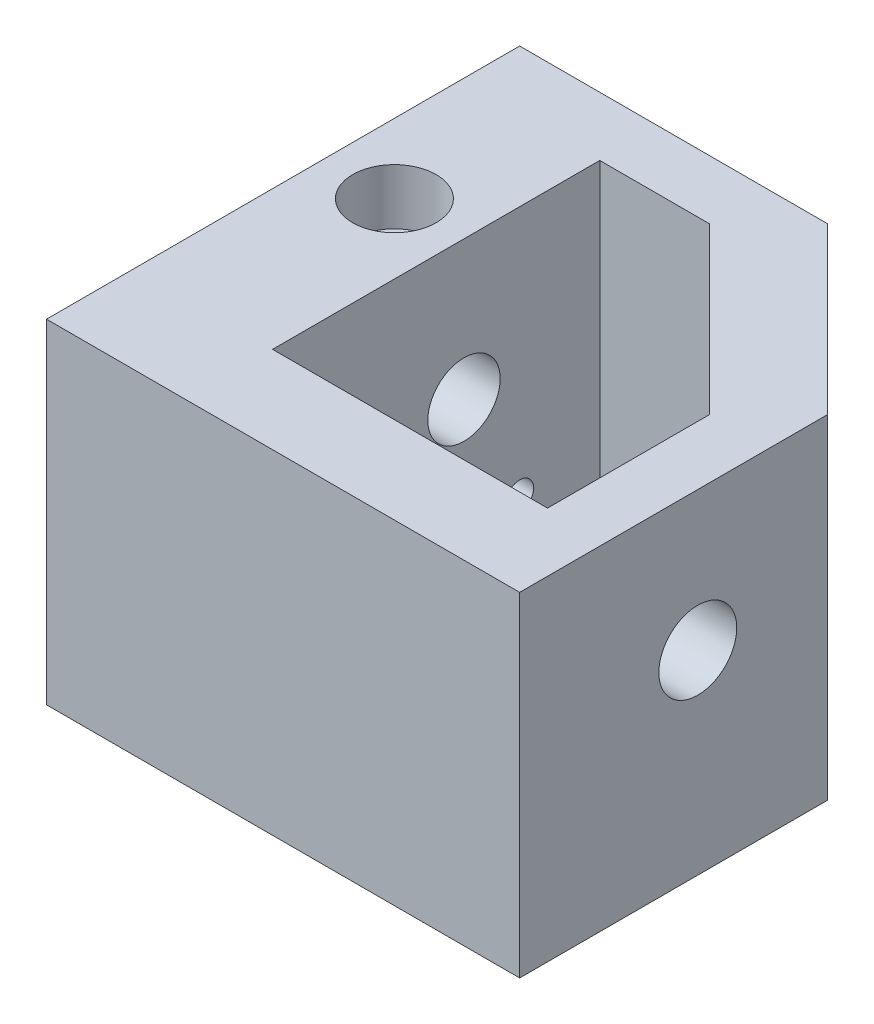
from build123d import *

# Parameters (mm, degrees)
BOSS_EXTRUDE2_DEPTH = 60
BOSS_EXTRUDE3_DEPTH = 10
CUT_EXTRUDE2_REACH  = 114.942
SKETCH8_R           = 4.75
SKETCH8_R_2         = 3
CUT_EXTRUDE3_REACH  = 113.611
SKETCH9_R           = 6.5
CUT_EXTRUDE4_REACH  = 113.611
SKETCH10_R          = 7
SKETCH12_R          = 7.5
CUT_EXTRUDE6_DEPTH  = 10
CUT_EXTRUDE16_REACH = 79.173
SKETCH24_R          = 2.25
SKETCH33_R          = 1.5
CUT_EXTRUDE18_DEPTH = 10
SKETCH37_W          = 85
SKETCH37_H          = 60
BOSS_EXTRUDE7_DEPTH = 5
SKETCH38_R          = 2.5
SKETCH38_R_2        = 2
CUT_EXTRUDE19_DEPTH = 20
CUT_EXTRUDE20_REACH = 115.516
SKETCH39_R          = 2.5
SKETCH40_R          = 2
CUT_EXTRUDE21_DEPTH = 10
SKETCH41_R          = 1.15
CUT_EXTRUDE22_DEPTH = 2.5


with BuildPart() as part:
    # Sketch1 → Boss-Extrude2 (new body)
    with BuildSketch(Plane(origin=(0, 0, 0), x_dir=(1, 0, 0), z_dir=(0, 1, 0))):
        Polygon((-42.705817414, 39.602616449), (-42.705817414, -40.397383551), (42.294182586, -40.397383551), (42.294182586, 9.904131639), (12.595697776, 39.602616449), align=None)
        Polygon((-17.705817414, 28.992616449), (-17.705817414, -29.787383551), (31.69097915, -29.787383551), (31.69097915, -0.705868361), (1.992494341, 28.992616449), align=None, mode=Mode.SUBTRACT)
    extrude(amount=BOSS_EXTRUDE2_DEPTH)

    # Sketch4 → Boss-Extrude3 (add)
    with BuildSketch(Plane(origin=(0, 0, 0), x_dir=(-1, 0, 0), z_dir=(0, -1, 0))):
        Polygon((17.705817414, 28.992616449), (-1.992494341, 28.992616449), (-31.69097915, -0.705868361), (-31.69097915, -29.787383551), (17.705817414, -29.787383551), align=None)
    extrude(amount=-BOSS_EXTRUDE3_DEPTH)

    # Sketch8 → Cut-Extrude2 (cut, up to next)
    with BuildSketch(Plane(origin=(26.099157113, 0, -26.099157113), x_dir=(-0.7071067811865456, 0, -0.7071067811865496), z_dir=(0.7071067811865496, 0, -0.7071067811865456)), mode=Mode.PRIVATE) as cut_extrude2_sk1:
        with Locations((11.096775332, 48)):
            Circle(SKETCH8_R)
    cut_extrude2_tool1 = extrude(cut_extrude2_sk1.sketch, amount=-CUT_EXTRUDE2_REACH, mode=Mode.PRIVATE) & part.part
    # Sketch8 → Cut-Extrude2 (cut, up to next)
    with BuildSketch(Plane(origin=(26.099157113, 0, -26.099157113), x_dir=(-0.7071067811865456, 0, -0.7071067811865496), z_dir=(0.7071067811865496, 0, -0.7071067811865456)), mode=Mode.PRIVATE) as cut_extrude2_sk2:
        with Locations((11.096775332, 34)):
            Circle(SKETCH8_R_2)
    cut_extrude2_tool2 = extrude(cut_extrude2_sk2.sketch, amount=-CUT_EXTRUDE2_REACH, mode=Mode.PRIVATE) & part.part
    # Sketch8 → Cut-Extrude2 (cut, up to next)
    with BuildSketch(Plane(origin=(26.099157113, 0, -26.099157113), x_dir=(-0.7071067811865456, 0, -0.7071067811865496), z_dir=(0.7071067811865496, 0, -0.7071067811865456)), mode=Mode.PRIVATE) as cut_extrude2_sk3:
        with Locations((11.096775332, 22)):
            Circle(SKETCH8_R)
    cut_extrude2_tool3 = extrude(cut_extrude2_sk3.sketch, amount=-CUT_EXTRUDE2_REACH, mode=Mode.PRIVATE) & part.part
    # Sketch8 → Cut-Extrude2 (cut, up to next)
    with BuildSketch(Plane(origin=(26.099157113, 0, -26.099157113), x_dir=(-0.7071067811865456, 0, -0.7071067811865496), z_dir=(0.7071067811865496, 0, -0.7071067811865456)), mode=Mode.PRIVATE) as cut_extrude2_sk4:
        with Locations((-0.903224668, 22)):
            Circle(SKETCH8_R_2)
    cut_extrude2_tool4 = extrude(cut_extrude2_sk4.sketch, amount=-CUT_EXTRUDE2_REACH, mode=Mode.PRIVATE) & part.part
    # Sketch8 → Cut-Extrude2 (cut, up to next)
    with BuildSketch(Plane(origin=(26.099157113, 0, -26.099157113), x_dir=(-0.7071067811865456, 0, -0.7071067811865496), z_dir=(0.7071067811865496, 0, -0.7071067811865456)), mode=Mode.PRIVATE) as cut_extrude2_sk5:
        with Locations((-14.903224668, 22)):
            Circle(SKETCH8_R)
    cut_extrude2_tool5 = extrude(cut_extrude2_sk5.sketch, amount=-CUT_EXTRUDE2_REACH, mode=Mode.PRIVATE) & part.part
    add(cut_extrude2_tool1.solids().sort_by_distance((18.252552, 48, -33.945762))[0], mode=Mode.SUBTRACT)
    add(cut_extrude2_tool2.solids().sort_by_distance((18.252552, 34, -33.945762))[0], mode=Mode.SUBTRACT)
    add(cut_extrude2_tool3.solids().sort_by_distance((18.252552, 22, -33.945762))[0], mode=Mode.SUBTRACT)
    add(cut_extrude2_tool4.solids().sort_by_distance((26.737833, 22, -25.460481))[0], mode=Mode.SUBTRACT)
    add(cut_extrude2_tool5.solids().sort_by_distance((36.637328, 22, -15.560986))[0], mode=Mode.SUBTRACT)

    # Sketch9 → Cut-Extrude3 (cut, up to next)
    with BuildSketch(Plane.ZY.offset(42.705817414), mode=Mode.PRIVATE) as cut_extrude3_sk1:
        with Locations((-4.602616449, 35)):
            Circle(SKETCH9_R)
    cut_extrude3_tool1 = extrude(cut_extrude3_sk1.sketch, amount=-CUT_EXTRUDE3_REACH, mode=Mode.PRIVATE) & part.part
    add(cut_extrude3_tool1.solids().sort_by_distance((-42.705817, 35, -4.602616))[0], mode=Mode.SUBTRACT)

    # Sketch10 → Cut-Extrude4 (cut, up to next)
    with BuildSketch(Plane(origin=(42.294182586, 0, 0), x_dir=(0, 0, -1), z_dir=(1, 0, 0)), mode=Mode.PRIVATE) as cut_extrude4_sk1:
        with Locations((-13.397383551, 35)):
            Circle(SKETCH10_R)
    cut_extrude4_tool1 = extrude(cut_extrude4_sk1.sketch, amount=-CUT_EXTRUDE4_REACH, mode=Mode.PRIVATE) & part.part
    add(cut_extrude4_tool1.solids().sort_by_distance((42.294183, 35, 13.397384))[0], mode=Mode.SUBTRACT)

    # Sketch12 → Cut-Extrude6 (cut)
    with BuildSketch(Plane(origin=(0, 60, 0), x_dir=(1, 0, 0), z_dir=(0, 1, 0))):
        with Locations((-30.205817414, 4.602616449)):
            Circle(SKETCH12_R)
    extrude(amount=-CUT_EXTRUDE6_DEPTH, mode=Mode.SUBTRACT)

    # Sketch24 → Cut-Extrude16 (cut, up to next)
    with BuildSketch(Plane(origin=(0, 50, 0), x_dir=(1, 0, 0), z_dir=(0, 1, 0)), mode=Mode.PRIVATE) as cut_extrude16_sk1:
        with Locations((-26.455817414, 4.602616449)):
            Circle(SKETCH24_R)
    cut_extrude16_tool1 = extrude(cut_extrude16_sk1.sketch, amount=-CUT_EXTRUDE16_REACH, mode=Mode.PRIVATE) & part.part
    # Sketch24 → Cut-Extrude16 (cut, up to next)
    with BuildSketch(Plane(origin=(0, 50, 0), x_dir=(1, 0, 0), z_dir=(0, 1, 0)), mode=Mode.PRIVATE) as cut_extrude16_sk2:
        with Locations((-33.955817414, 4.602616449)):
            Circle(SKETCH24_R)
    cut_extrude16_tool2 = extrude(cut_extrude16_sk2.sketch, amount=-CUT_EXTRUDE16_REACH, mode=Mode.PRIVATE) & part.part
    add(cut_extrude16_tool1.solids().sort_by_distance((-26.455817, 50, -4.602616))[0], mode=Mode.SUBTRACT)
    add(cut_extrude16_tool2.solids().sort_by_distance((-33.955817, 50, -4.602616))[0], mode=Mode.SUBTRACT)

    # Sketch33 → Cut-Extrude18 (cut)
    with BuildSketch(Plane.ZY.offset(42.705817414)):
        with Locations((5.397383551, 38)):
            Circle(SKETCH33_R)
        with Locations((5.397383551, 32)):
            Circle(SKETCH33_R)
    extrude(amount=-CUT_EXTRUDE18_DEPTH, mode=Mode.SUBTRACT)

    # Sketch37 → Boss-Extrude7 (add)
    with BuildSketch(Plane.XY.offset(40.397383551)):
        with Locations((-0.205817414, 30)):
            Rectangle(SKETCH37_W, SKETCH37_H)
    extrude(amount=BOSS_EXTRUDE7_DEPTH)

    # Sketch38 → Cut-Extrude19 (cut)
    with BuildSketch(Plane.ZY.offset(42.705817414)):
        with Locations((-19.602616449, 5)):
            Circle(SKETCH38_R)
        with Locations((25.397383551, 5)):
            Circle(SKETCH38_R)
        with Locations((-36.852616449, 40)):
            Circle(SKETCH38_R_2)
        with Locations((42.647383551, 40)):
            Circle(SKETCH38_R_2)
    extrude(amount=-CUT_EXTRUDE19_DEPTH, mode=Mode.SUBTRACT)

    # Sketch39 → Cut-Extrude20 (cut, up to next)
    with BuildSketch(Plane.ZY.offset(42.705817414), mode=Mode.PRIVATE) as cut_extrude20_sk1:
        with Locations((-14.602616449, 15)):
            Circle(SKETCH39_R)
    cut_extrude20_tool1 = extrude(cut_extrude20_sk1.sketch, amount=-CUT_EXTRUDE20_REACH, mode=Mode.PRIVATE) & part.part
    add(cut_extrude20_tool1.solids().sort_by_distance((-42.705817, 15, -14.602616))[0], mode=Mode.SUBTRACT)

    # Sketch40 → Cut-Extrude21 (cut)
    with BuildSketch(Plane.XZ):
        with Locations((-36.705817414, -33.602616449)):
            Circle(SKETCH40_R)
        with Locations((-36.705817414, 39.397383551)):
            Circle(SKETCH40_R)
        with Locations((36.294182586, 39.397383551)):
            Circle(SKETCH40_R)
        with Locations((36.294182586, -7.418850265)):
            Circle(SKETCH40_R)
        with Locations((10.110416402, -33.602616449)):
            Circle(SKETCH40_R)
    extrude(amount=-CUT_EXTRUDE21_DEPTH, mode=Mode.SUBTRACT)

    # Sketch41 → Cut-Extrude22 (cut)
    with BuildSketch(Plane(origin=(26.099157113, 0, -26.099157113), x_dir=(-0.7071067811865456, 0, -0.7071067811865496), z_dir=(0.7071067811865496, 0, -0.7071067811865456))):
        with Locations((14.096775332, 34)):
            Circle(SKETCH41_R)
        with Locations((8.096775332, 34)):
            Circle(SKETCH41_R)
        with Locations((-0.903224668, 25)):
            Circle(SKETCH41_R)
        with Locations((-0.903224668, 19)):
            Circle(SKETCH41_R)
    extrude(amount=-CUT_EXTRUDE22_DEPTH, mode=Mode.SUBTRACT)


solid = part.part
